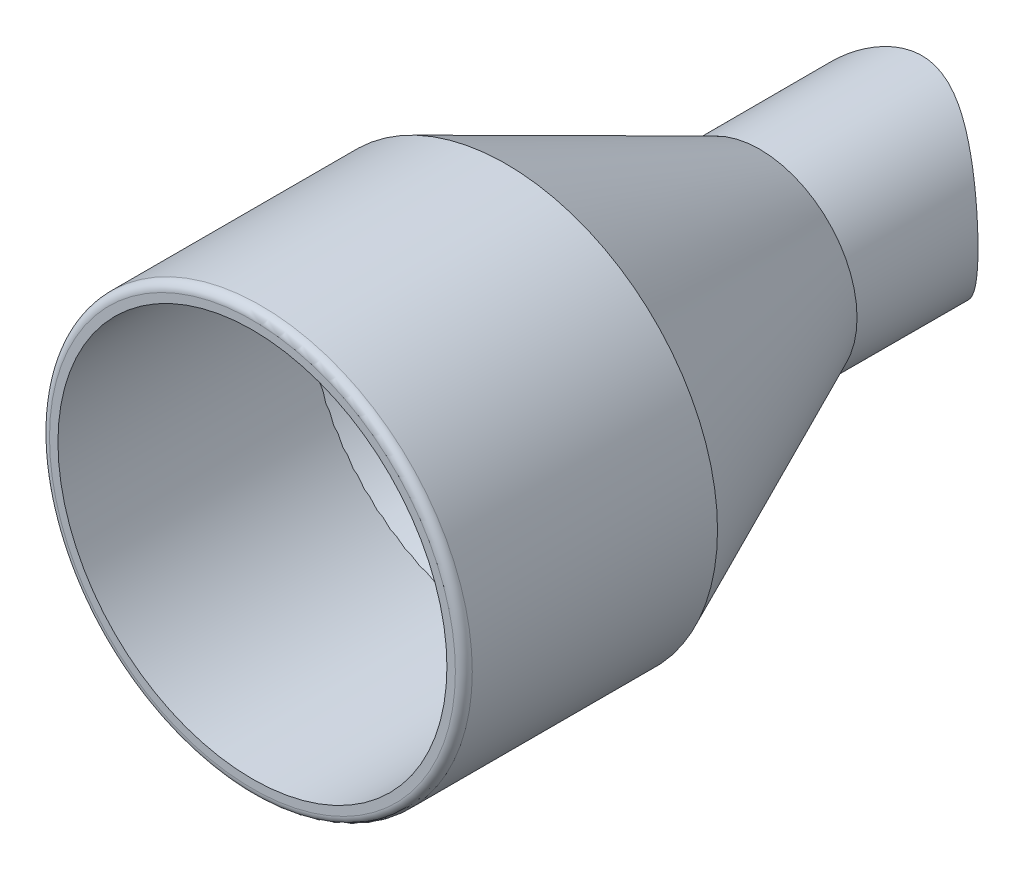
from build123d import *

# Parameters (mm, degrees)
SKETCH1_R           = 25
SKETCH1_R_2         = 23
BOSS_EXTRUDE1_DEPTH = 30
FILLET1_R           = 1
SKETCH7_R           = 11.5
SKETCH7_R_2         = 9.67615699
BOSS_EXTRUDE2_DEPTH = 20
SKETCH8_R           = 16
CUT_EXTRUDE1_DEPTH  = 15


with BuildPart() as part:
    # Sketch1 → Boss-Extrude1 (new body)
    with BuildSketch(Plane.XY):
        Circle(SKETCH1_R)
        Circle(SKETCH1_R_2, mode=Mode.SUBTRACT)
    extrude(amount=BOSS_EXTRUDE1_DEPTH)

    # Fillet1
    fillet1_edges = [part.edges().sort_by_distance(p)[0] for p in [
        (-25, 0, 30),
    ]]
    fillet(fillet1_edges, radius=FILLET1_R)


with BuildPart() as body_2:
    # Sketch5 → Revolve-Thin1 (revolve)
    with BuildSketch(Plane(origin=(0, 0, 0), x_dir=(0, 0, -1), z_dir=(1, 0, 0))):
        Polygon((30, 11.5), (0, 25), (-0.820729355, 23.17615699), (29.179270645, 9.67615699), align=None)
    revolve(axis=Axis((0, 0, 0), (0, 0, -1)))

    # Sketch7 → Boss-Extrude2 (add)
    with BuildSketch(Plane(origin=(0, 0, -29.179270645), x_dir=(-1, 0, 0), z_dir=(0, 0, -1))):
        Circle(SKETCH7_R)
        Circle(SKETCH7_R_2, mode=Mode.SUBTRACT)
    extrude(amount=BOSS_EXTRUDE2_DEPTH)

    # Sketch8 → Cut-Extrude1 (cut, symmetric)
    with BuildSketch(Plane(origin=(0, 0, 0), x_dir=(0, 0, -1), z_dir=(1, 0, 0))):
        with Locations((60.303568376, 0)):
            Circle(SKETCH8_R)
    extrude(amount=CUT_EXTRUDE1_DEPTH, both=True, mode=Mode.SUBTRACT)


solid = Compound([part.part, body_2.part])
